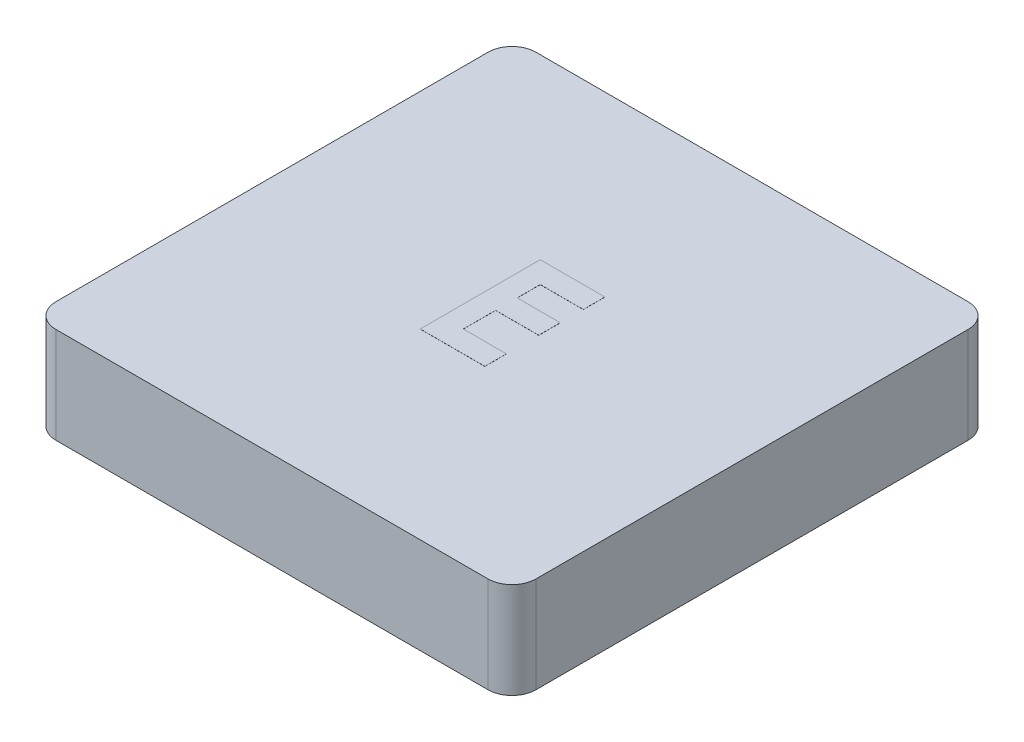
from build123d import *

# Parameters (mm, degrees)
SKETCH1_W           = 12.7
SKETCH1_H           = 12.7
BOSS_EXTRUDE1_DEPTH = 2.54
FILLET1_R           = 0.635
SHELL1_START        = 0.635
SHELL1_OUTLINE_W    = 1.905
SHELL1_OUTLINE_H    = 11.43
SHELL1_DEPTH        = 11.43
SKETCH2_R           = 2.54
BOSS_EXTRUDE2_DEPTH = 1.905
BOSS_EXTRUDE3_DEPTH = 0.00254


# Read off the part's stored shape, not the designer's step: Shell1
with BuildPart() as part:
    # Sketch1 → Boss-Extrude1 (new body)
    with BuildSketch(Plane(origin=(0, 0, 0), x_dir=(1, 0, 0), z_dir=(0, 1, 0))):
        with Locations((6.35, 6.35)):
            Rectangle(SKETCH1_W, SKETCH1_H)
    extrude(amount=BOSS_EXTRUDE1_DEPTH)

    # Fillet1
    fillet1_edges = [part.edges().sort_by_distance(p)[0] for p in [
        (0, 1.27, -12.7),
        (12.7, 1.27, -12.7),
        (12.7, 1.27, 0),
        (0, 1.27, 0),
    ]]
    fillet(fillet1_edges, radius=FILLET1_R)

    # Shell1 outline → Shell1 (cut)
    with BuildSketch(Plane.YZ.offset(SHELL1_START)):
        with Locations((0.9525, -6.35)):
            Rectangle(SHELL1_OUTLINE_W, SHELL1_OUTLINE_H)
    extrude(amount=SHELL1_DEPTH, mode=Mode.SUBTRACT)

    # Sketch2 → Boss-Extrude2 (add)
    with BuildSketch(Plane(origin=(0, 1.905, 0), x_dir=(-1, 0, 0), z_dir=(0, -1, 0))):
        with Locations(Location((-6.35, 6.35, 0), (0, 0, 270))):
            Circle(SKETCH2_R)
    extrude(amount=BOSS_EXTRUDE2_DEPTH)

    # Sketch3 → Boss-Extrude3 (add)
    with BuildSketch(Plane(origin=(0, 2.54, 0), x_dir=(1, 0, 0), z_dir=(0, 1, 0))):
        Polygon((5.446346154, 8.001), (7.155961538, 8.001), (7.155961538, 7.431128205), (6.016217949, 7.431128205), (6.016217949, 6.820551282), (7.155961538, 6.820551282), (7.155961538, 6.250679487), (6.016217949, 6.250679487), (6.016217949, 5.395871795), (7.155961538, 5.395871795), (7.155961538, 4.826), (5.446346154, 4.826), align=None)
    extrude(amount=BOSS_EXTRUDE3_DEPTH)


solid = part.part
